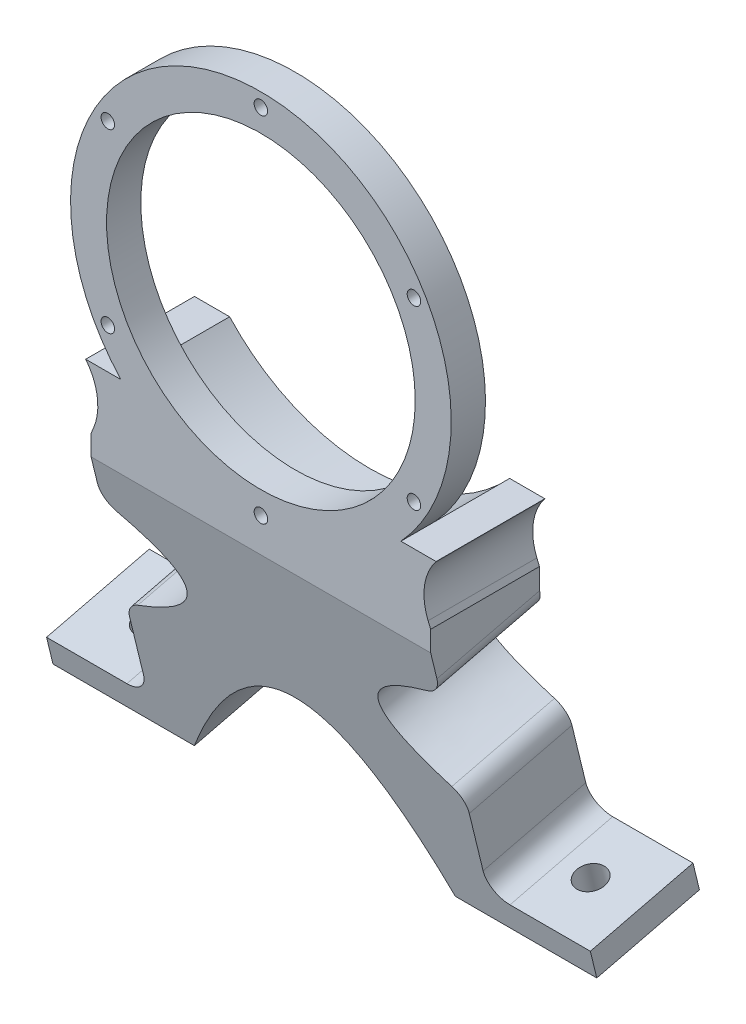
from build123d import *
from build123d.topology import SkipClean

# Parameters (mm, degrees)
SKETCH1_R                       = 44.45
SKETCH1_R_2                     = 36.0426
SKETCH1_R_3                     = 1.575
BOSS_EXTRUDE1_DEPTH             = 8
BOSS_EXTRUDE2_START             = -25.4
BOSS_EXTRUDE2_DEPTH             = 25.4
SKETCH5_W                       = 127
SKETCH5_H                       = 24.677347648
BOSS_EXTRUDE3_DEPTH             = 22.86
BOSS_EXTRUDE3_DIRECTION_2_REACH = 117.98
CUT_EXTRUDE1_DEPTH              = 103.517532245
CUT_EXTRUDE2_DEPTH              = 106.121352295
SKETCH8_R                       = 3.2639
CUT_EXTRUDE3_DEPTH              = 132.797554186
SKETCH10_W                      = 23.84426271
SKETCH10_H                      = 24.677347648
SKETCH10_R                      = 3.2639
BOSS_EXTRUDE4_DEPTH             = 34.23412
FILLET3_START                   = -19.427790223
FILLET3_DEPTH                   = 24.677347648
FILLET4_R                       = 12.7
SKETCH11_W                      = 23.84426271
SKETCH11_H                      = 32.29864
CUT_EXTRUDE4_DEPTH              = 134.162391299
BOSS_EXTRUDE5_DEPTH             = 24.677347648
FILLET5_R                       = 5.08
CUT_EXTRUDE5_DEPTH              = 134.162391299
CUT_EXTRUDE6_DEPTH              = 134.162391464
FILLET6_START                   = -20
FILLET6_DEPTH                   = 26.377499095


with BuildPart() as part:
    # Sketch1 → Boss-Extrude1 (new body)
    with BuildSketch(Plane.XY):
        Circle(SKETCH1_R)
        Circle(SKETCH1_R_2, mode=Mode.SUBTRACT)
        with Locations((35.745198541, 20.6375)):
            Circle(SKETCH1_R_3, mode=Mode.SUBTRACT)
        with Locations((0, 41.275)):
            Circle(SKETCH1_R_3, mode=Mode.SUBTRACT)
        with Locations((-35.745198541, 20.6375)):
            Circle(SKETCH1_R_3, mode=Mode.SUBTRACT)
        with Locations((-35.745198541, -20.6375)):
            Circle(SKETCH1_R_3, mode=Mode.SUBTRACT)
        with Locations((0, -41.275)):
            Circle(SKETCH1_R_3, mode=Mode.SUBTRACT)
        with Locations((35.745198541, -20.6375)):
            Circle(SKETCH1_R_3, mode=Mode.SUBTRACT)
    extrude(amount=BOSS_EXTRUDE1_DEPTH)

    # Sketch4 → Boss-Extrude2 (add)
    with BuildSketch(Plane.XY.offset(8).offset(BOSS_EXTRUDE2_START)):
        with BuildLine():
            Line((-39.65573729, -44.45), (-63.5, -44.45))
            Line((-63.5, -44.45), (-63.5, -49.2125))
            Line((-63.5, -49.2125), (63.5, -49.2125))
            Line((63.5, -49.2125), (63.5, -44.45))
            Line((63.5, -44.45), (39.65573729, -44.45))
            Line((39.65573729, -44.45), (36.050670263, -35.790909091))
            ThreePointArc((36.050670263, -35.790909091), (38.587710733, -33.039802972), (40.915335308, -30.10938951))
            Line((40.915335308, -30.10938951), (32.699039181, -30.10938951))
            ThreePointArc((32.699039181, -30.10938951), (0, -44.45), (-32.699039181, -30.10938951))
            Line((-32.699039181, -30.10938951), (-40.915335308, -30.10938951))
            ThreePointArc((-40.915335308, -30.10938951), (-38.587710733, -33.039802972), (-36.050670263, -35.790909091))
            Line((-36.050670263, -35.790909091), (-39.65573729, -44.45))
        make_face()
    extrude(amount=BOSS_EXTRUDE2_DEPTH)

    # Sketch5 → Boss-Extrude3 (add)
    with BuildSketch(Plane(origin=(0, -50.455795448, -12.299797104), x_dir=(-1, 0, 0), z_dir=(0, -0.971549119997646, -0.2368381460656192))):
        with Locations((0, -7.089116399)):
            Rectangle(SKETCH5_W, SKETCH5_H)
    extrude(amount=BOSS_EXTRUDE3_DEPTH)

    # Boss-Extrude3 direction 2: up to this face of the body (flat: up to its plane)
    boss_extrude3_direction_2_end = Plane(part.part.faces().sort_by_distance((0, -49.2125, -4.7))[0])
    # Sketch5 → Boss-Extrude3 direction 2 (add, up to the picked face)
    with BuildSketch(Plane(origin=(0, -50.455795448, -12.299797104), x_dir=(-1, 0, 0), z_dir=(0, -0.971549119997646, -0.2368381460656192)), mode=Mode.PRIVATE) as boss_extrude3_direction_2_sk1:
        with Locations((0, -7.089116399)):
            Rectangle(SKETCH5_W, SKETCH5_H)
    boss_extrude3_direction_2_tool1 = split(extrude(boss_extrude3_direction_2_sk1.sketch, amount=-BOSS_EXTRUDE3_DIRECTION_2_REACH, mode=Mode.PRIVATE), bisect_by=boss_extrude3_direction_2_end, keep=Keep.BOTH, mode=Mode.PRIVATE)
    add(boss_extrude3_direction_2_tool1.solids().sort_by(Axis((0, -52.134769, -5.412372), (0, 0.971549119997646, 0.2368381460656192)))[0])

    # Sketch6 → Cut-Extrude1 (cut, through all)
    with BuildSketch(Plane(origin=(0, 1.243295448, -5.100202896), x_dir=(-1, 0, 0), z_dir=(0, 0.23683814606561915, -0.971549119997646))):
        with BuildLine():
            Line((-39.65573729, -74.793344809), (-39.65573729, -84.912644386))
            Line((-39.65573729, -84.912644386), (39.65573729, -84.912644386))
            Line((39.65573729, -84.912644386), (39.65573729, -74.793344809))
            add(Edge.make_bspline(
                [(-39.65573729, -74.793344809), (0, -52.373165884), (39.65573729, -74.793344809)],
                knots=[0, 0, 0, 1, 1, 1], degree=2))
        make_face()
    extrude(amount=-CUT_EXTRUDE1_DEPTH, mode=Mode.SUBTRACT)

    # Sketch7 → Cut-Extrude2 (cut, through all)
    with BuildSketch(Plane(origin=(0, -4.601241819, 18.875052495), x_dir=(1, 0, 0), z_dir=(0, -0.23683814606561915, 0.971549119997646))):
        Polygon((-39.65573729, -41.290653215), (-39.65573729, -70.378824809), (-63.5, -70.378824809), (-63.5, -38.21123826), (-39.65573729, -38.21123826), align=None)
        Polygon((39.65573729, -70.378824809), (63.5, -70.378824809), (63.5, -38.21123826), (39.65573729, -38.21123826), (39.65573729, -41.290653215), align=None)
    extrude(amount=-CUT_EXTRUDE2_DEPTH, mode=Mode.SUBTRACT)

    # Sketch8 → Cut-Extrude3 (cut, through all)
    with BuildSketch(Plane(origin=(0, -68.37648531, -16.66839039), x_dir=(1, 0, 0), z_dir=(0, 0.971549119997646, 0.2368381460656191))):
        with Locations(Location((51.577868645, -7.089116399, 0), (0, 0, 270))):
            Circle(SKETCH8_R)
        with Locations(Location((-51.577868645, -7.089116399, 0), (0, 0, 270))):
            Circle(SKETCH8_R)
    extrude(amount=-CUT_EXTRUDE3_DEPTH, mode=Mode.SUBTRACT)

    # Sketch10 → Boss-Extrude4 (add)
    # profile 1 of 2: a face of its own
    with SkipClean():  # the faces are left unmerged after this step: merging them gives an invalid solid
        with BuildSketch(Plane(origin=(0, -72.665408331, -17.713917123), x_dir=(1, 0, 0), z_dir=(0, -0.9715491199976461, -0.23683814606561926))):
            with Locations((-51.577868645, 7.089116399)):
                Rectangle(SKETCH10_W, SKETCH10_H)
            with Locations(Location((-51.577868645, 7.089116399, 0), (0, 0, 270))):
                Circle(SKETCH10_R, mode=Mode.SUBTRACT)
        # profile 2 of 2: a face of its own
        with BuildSketch(Plane(origin=(0, -72.665408331, -17.713917123), x_dir=(1, 0, 0), z_dir=(0, -0.9715491199976461, -0.23683814606561926))):
            with Locations((51.577868645, 7.089116399)):
                Rectangle(SKETCH10_W, SKETCH10_H)
            with Locations(Location((51.577868645, 7.089116399, 0), (0, 0, 90))):
                Circle(SKETCH10_R, mode=Mode.SUBTRACT)
        extrude(amount=BOSS_EXTRUDE4_DEPTH)
    add(part.part.scale(1), mode=Mode.REPLACE)  # the faces are merged on a copy

    # Fillet3: read off the stored shape, not the designer's step
    # Fillet3 outline → Fillet3 (add)
    with SkipClean():  # the faces are left unmerged after this step: merging them gives an invalid solid
        with BuildSketch(Plane(origin=(0, 0, 0), x_dir=(1, 0, 0), z_dir=(0, 0.23683814606561904, -0.9715491199976461)).offset(FILLET3_START)):
            with BuildLine():
                ThreePointArc((0, 75.867019335), (-23.207224812, 88.40595558), (-39.65573729, 109.027464809))
                Line((-39.65573729, 109.027464809), (-39.65573729, 74.793344809))
                add(Edge.make_bspline(
                    [(39.65573729, 74.793344809), (0, 52.373165884), (-39.65573729, 74.793344809)],
                    knots=[0, 0, 0, 1, 1, 1], degree=2))
                Line((39.65573729, 74.793344809), (39.65573729, 109.027464809))
                ThreePointArc((39.65573729, 109.027464809), (23.207224812, 88.40595558), (0, 75.867019335))
            make_face()
        extrude(amount=FILLET3_DEPTH)

    # Fillet4
    fillet4_edges = [part.edges().sort_by_distance(p)[0] for p in [
        (36.050670263, -35.790909091, -4.7),
        (-36.050670263, -35.790909091, -4.7),
    ]]
    fillet(fillet4_edges, radius=FILLET4_R)

    # Sketch11 → Cut-Extrude4 (cut, through all)
    with BuildSketch(Plane(origin=(0, -4.601241819, 18.875052495), x_dir=(1, 0, 0), z_dir=(0, -0.2368381460656192, 0.9715491199976461))):
        with Locations((-51.577868645, -86.528144809)):
            Rectangle(SKETCH11_W, SKETCH11_H)
        with Locations((51.577868645, -86.528144809)):
            Rectangle(SKETCH11_W, SKETCH11_H)
    extrude(amount=-CUT_EXTRUDE4_DEPTH, mode=Mode.SUBTRACT)

    # Sketch12 → Boss-Extrude5 (add)
    with BuildSketch(Plane(origin=(0, -4.601241819, 18.875052495), x_dir=(1, 0, 0), z_dir=(0, -0.2368381460656192, 0.9715491199976461))):
        Polygon((-39.65573729, -109.027464809), (39.65573729, -109.027464809), (30.485915065, -74.825591671), (-33.624171028, -74.825591671), align=None)
    extrude(amount=-BOSS_EXTRUDE5_DEPTH)

    # Fillet5
    fillet5_edges = [part.edges().sort_by_distance(p)[0] for p in [
        (-39.65573729, -101.435173764, -17.430515609),
        (39.65573729, -101.435173764, -17.430515609),
    ]]
    fillet(fillet5_edges, radius=FILLET5_R)

    # Sketch13 → Cut-Extrude5 (cut, through all)
    with BuildSketch(Plane(origin=(0, -4.601241819, 18.875052495), x_dir=(1, 0, 0), z_dir=(0, -0.2368381460656192, 0.9715491199976461))):
        with BuildLine():
            Line((-30.48, -109.027464809), (-30.48, -117.81515038))
            Line((-30.48, -117.81515038), (30.48, -117.81515038))
            Line((30.48, -117.81515038), (30.48, -109.027464809))
            add(Edge.make_bspline(
                [(-30.48, -109.027464809), (0, -50.4868087), (30.48, -109.027464809)],
                knots=[0, 0, 0, 1, 1, 1], degree=2))
        make_face()
    extrude(amount=-CUT_EXTRUDE5_DEPTH, mode=Mode.SUBTRACT)

    # Sketch14 → Cut-Extrude6 (cut, through all)
    with BuildSketch(Plane(origin=(0, -4.601241819, 18.875052495), x_dir=(1, 0, 0), z_dir=(0, -0.2368381460656192, 0.9715491199976461))):
        with BuildLine():
            Line((-39.65573729, -55.771894755), (-39.65573729, -80.653781316))
            add(Edge.make_bspline(
                [(-39.65573729, -55.771894755), (-5.12128529, -66.290498293), (-39.65573729, -80.653781316)],
                knots=[0, 0, 0, 1, 1, 1], degree=2))
        make_face()
        with BuildLine():
            Line((39.65573729, -80.653781316), (39.65573729, -55.771894755))
            add(Edge.make_bspline(
                [(39.65573729, -55.771894755), (5.12128529, -66.290498293), (39.65573729, -80.653781316)],
                knots=[0, 0, 0, 1, 1, 1], degree=2))
        make_face()
    extrude(amount=-CUT_EXTRUDE6_DEPTH, mode=Mode.SUBTRACT)

    # Fillet6: read off the stored shape, not the designer's step
    # Fillet6 outline → Fillet6 (cut)
    with BuildSketch(Plane(origin=(0, 0, 0), x_dir=(1, 0, 0), z_dir=(0, 0.23683814606561904, -0.9715491199976461)).offset(FILLET6_START)):
        with BuildLine():
            Line((-39.65573729, 55.771894755), (-39.65573729, 52.0803589))
            ThreePointArc((-39.65573729, 52.0803589), (-38.714392857, 55.026191566), (-36.239229378, 56.880274949))
            add(Edge.make_bspline(
                [(-36.239229378, 56.880274949), (-37.853422524, 56.320849013), (-39.65573729, 55.771894755)],
                knots=[0.947811109, 0.947811109, 0.947811109, 1, 1, 1], degree=2))
        make_face()
        with BuildLine():
            add(Edge.make_bspline(
                [(-39.65573729, 80.653781316), (-38.090633643, 80.00283638), (-36.667391198, 79.359788064)],
                knots=[0, 0, 0, 0.045320066, 0.045320066, 0.045320066], degree=2))
            ThreePointArc((-36.667391198, 79.359788064), (-38.843758017, 81.234124448), (-39.65573729, 83.989192337))
            Line((-39.65573729, 83.989192337), (-39.65573729, 80.653781316))
        make_face()
        with BuildLine():
            add(Edge.make_bspline(
                [(39.65573729, 55.771894755), (37.853422524, 56.320849013), (36.239229378, 56.880274949)],
                knots=[0, 0, 0, 0.052188891, 0.052188891, 0.052188891], degree=2))
            ThreePointArc((36.239229378, 56.880274949), (38.714392857, 55.026191566), (39.65573729, 52.0803589))
            Line((39.65573729, 52.0803589), (39.65573729, 55.771894755))
        make_face()
        with BuildLine():
            ThreePointArc((39.65573729, 83.989192337), (38.843758017, 81.234124448), (36.667391198, 79.359788064))
            add(Edge.make_bspline(
                [(36.667391198, 79.359788064), (38.090633643, 80.00283638), (39.65573729, 80.653781316)],
                knots=[0.954679934, 0.954679934, 0.954679934, 1, 1, 1], degree=2))
            Line((39.65573729, 80.653781316), (39.65573729, 83.989192337))
        make_face()
    extrude(amount=FILLET6_DEPTH, mode=Mode.SUBTRACT)


solid = part.part
